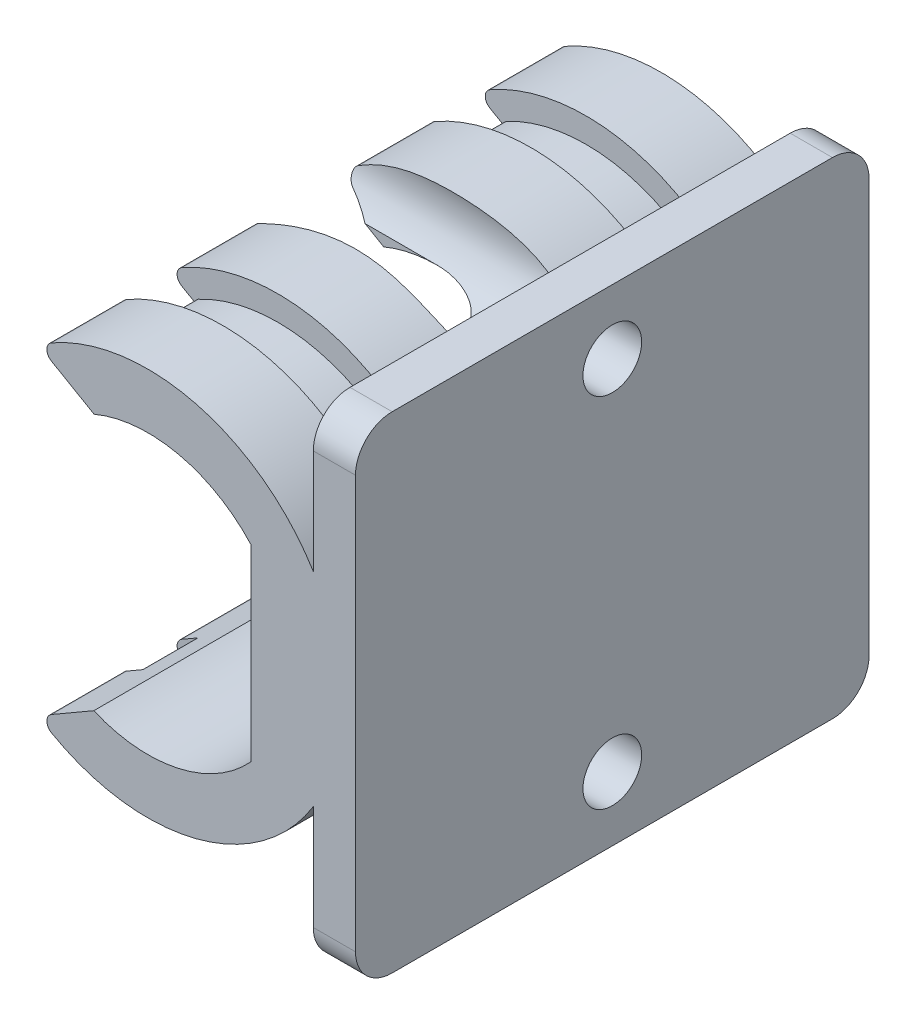
from build123d import *

# Parameters (mm, degrees)
SALIENTE_EXTRUIR1_DEPTH      = 14.6
SALIENTE_EXTRUIR1_DEPTH_BACK = 14.6
SALIENTE_EXTRUIR2_START      = -2.6
SALIENTE_EXTRUIR2_DEPTH      = 2.6
SALIENTE_EXTRUIR3_START      = -14.6
CROQUIS3_W                   = 2.3
CROQUIS3_H                   = 47.938039211
SALIENTE_EXTRUIR3_DEPTH      = 29.2
CROQUIS6_R                   = 1.6
CORTAR_EXTRUIR1_DEPTH        = 20
CROQUIS7_R                   = 2.8
CORTAR_EXTRUIR2_DEPTH        = 20
CROQUIS8_R                   = 2.8
CORTAR_EXTRUIR3_DEPTH        = 33
CROQUIS9_OUTSIDE_W           = 42.946
CROQUIS9_OUTSIDE_H           = 61.684
CROQUIS9_OUTSIDE_W_2         = 28
CROQUIS9_OUTSIDE_H_2         = 26.5
CORTAR_EXTRUIR4_DEPTH        = 33
CORTAR_EXTRUIR5_DEPTH        = 23.234812396
CORTAR_EXTRUIR5_DEPTH_BACK   = 23.234812396
CROQUIS10_W                  = 1.7
CROQUIS10_H                  = 3
CORTAR_EXTRUIR6_DEPTH        = 23.234812396
CORTAR_EXTRUIR6_DEPTH_BACK   = 23.234812396
REDONDEO1_R                  = 2
REDONDEO3_R                  = 0.5
CROQUIS15_W                  = 3
CROQUIS15_H                  = 1.5
SALIENTE_EXTRUIR4_REACH      = 26.646
CROQUIS16_W                  = 3
CROQUIS16_H                  = 0.184923787
SALIENTE_EXTRUIR5_REACH      = 26.646
CROQUIS17_W                  = 3
CROQUIS17_H                  = 0.184923787
REDONDEO6_R                  = 0.2
REDONDEO7_R                  = 0.5


with BuildPart() as part:
    # Croquis1 → Saliente-Extruir1 (new, two sides: drawn at the far end of the back side and taken through both)
    with BuildSketch(Plane.XY.offset(-SALIENTE_EXTRUIR1_DEPTH_BACK)):
        with BuildLine():
            Line((-9.894524811, -9.657282728), (-6.867524861, -7.909281629))
            ThreePointArc((-6.867524861, -7.909281629), (3.691458353, -0.918186433), (-6.851112712, 6.097633825))
            Line((-6.851112712, 6.097633825), (-9.894524811, 7.855112444))
            ThreePointArc((-9.894524811, 7.855112444), (6.67014921, -0.901085142), (-9.894524811, -9.657282728))
        make_face()
    extrude(amount=SALIENTE_EXTRUIR1_DEPTH + SALIENTE_EXTRUIR1_DEPTH_BACK)

    # Croquis2 → Saliente-Extruir2 (add)
    with BuildSketch(Plane.XY.offset(14.6).offset(SALIENTE_EXTRUIR2_START)):
        with BuildLine():
            Line((1.69167133, 4.22850409), (1.69167133, -6.047067348))
            ThreePointArc((1.69167133, -6.047067348), (3.69146357, -0.909281629), (1.69167133, 4.22850409))
        make_face()
    saliente_extruir2 = extrude(amount=SALIENTE_EXTRUIR2_DEPTH)

    # Simetría1: Saliente-Extruir2 across plane
    add(saliente_extruir2.mirror(Plane.XY))

    # Croquis3 → Saliente-Extruir3 (add)
    with BuildSketch(Plane.XY.offset(SALIENTE_EXTRUIR3_START)):
        with Locations((6.25, -0.90928163)):
            Rectangle(CROQUIS3_W, CROQUIS3_H)
    extrude(amount=SALIENTE_EXTRUIR3_DEPTH)

    # Croquis6 → Cortar-Extruir1 (cut)
    with BuildSketch(Plane(origin=(7.4, 0, 0), x_dir=(0, 0, -1), z_dir=(1, 0, 0))):
        with Locations(Location((0, 8.840718371, 0), (0, 0, 90))):
            Circle(CROQUIS6_R)
        with Locations(Location((0, -10.659281629, 0), (0, 0, 90))):
            Circle(CROQUIS6_R)
    extrude(amount=-CORTAR_EXTRUIR1_DEPTH, mode=Mode.SUBTRACT)

    # Croquis7 → Cortar-Extruir2 (cut)
    with BuildSketch(Plane.ZY.offset(-5.1)):
        with Locations((0, -10.659281629)):
            Circle(CROQUIS7_R)
    extrude(amount=CORTAR_EXTRUIR2_DEPTH, mode=Mode.SUBTRACT)

    # Croquis8 → Cortar-Extruir3 (cut)
    with BuildSketch(Plane.ZY.offset(-5.1)):
        with Locations((0, 8.840718371)):
            Circle(CROQUIS8_R)
    extrude(amount=CORTAR_EXTRUIR3_DEPTH, mode=Mode.SUBTRACT)

    # Croquis9 outside → Cortar-Extruir4 (cut)
    with BuildSketch(Plane(origin=(7.4, 0, 0), x_dir=(0, 0, -1), z_dir=(1, 0, 0))):
        with Locations((0, -0.909)):
            Rectangle(CROQUIS9_OUTSIDE_W, CROQUIS9_OUTSIDE_H)
        with Locations((0, -0.909281629)):
            Rectangle(CROQUIS9_OUTSIDE_W_2, CROQUIS9_OUTSIDE_H_2, mode=Mode.SUBTRACT)
    extrude(amount=-CORTAR_EXTRUIR4_DEPTH, mode=Mode.SUBTRACT)

    # Croquis10 → Cortar-Extruir5 (cut, two sides: drawn at the far end of the back side and taken through both)
    with BuildSketch(Plane(origin=(0, 0, 0), x_dir=(1, 0, 0), z_dir=(0, 1, 0)).offset(-CORTAR_EXTRUIR5_DEPTH_BACK)):
        with Locations((4.25, 8.400005124)):
            Rectangle(CROQUIS10_W, CROQUIS10_H)
        with Locations((4.25, -8.400005124)):
            Rectangle(CROQUIS10_W, CROQUIS10_H)
    extrude(amount=CORTAR_EXTRUIR5_DEPTH + CORTAR_EXTRUIR5_DEPTH_BACK, mode=Mode.SUBTRACT)

    # Croquis11 → Cortar-Extruir6 (cut, two sides: drawn at the far end of the back side and taken through both)
    with BuildSketch(Plane(origin=(0, 0, 0), x_dir=(1, 0, 0), z_dir=(0, 1, 0)).offset(-CORTAR_EXTRUIR6_DEPTH_BACK)):
        Polygon((-12.518535399, 1.793593931), (-3.91121133, 1.793593931), (-3.91121133, -1.793519439), (-12.439482954, -1.790719456), align=None)
    extrude(amount=CORTAR_EXTRUIR6_DEPTH + CORTAR_EXTRUIR6_DEPTH_BACK, mode=Mode.SUBTRACT)

    # Redondeo1
    redondeo1_edges = [part.edges().sort_by_distance(p)[0] for p in [
        (6.25, 12.340718371, -14),
        (6.25, -14.159281629, -14),
        (6.25, -14.159281629, 14),
        (6.25, 12.340718371, 14),
    ]]
    fillet(redondeo1_edges, radius=REDONDEO1_R)

    # Redondeo3
    # the kernel refuses this fillet: 0.5 mm, written as the material it takes off along each edge
    with BuildSketch(Plane(origin=(-9.894524811, -9.657282728, 0.483565685), x_dir=(0.8483027718418479, -0.5295114798429189, 0), z_dir=(0, 0, 1)), Plane(origin=(-9.894524811, -9.657282728, -16.131008506), x_dir=(0.8483027718418479, -0.5295114798429189, 0), z_dir=(0, 0, 1))) as redondeo3_piece_1:
        with BuildLine():
            CenterArc((0.832293154, 0.499595414), REDONDEO3_R, 151.977590228, 120.327496284)
            Line((0.390911202, 0.734503849), (0, 0))
            ThreePointArc((0, 0), (0.426201701, -0.008574491), (0.852403402, 0))
        make_face()
    extrude(amount=15.647442821, mode=Mode.SUBTRACT)
    with BuildSketch(Plane(origin=(-9.894524811, 7.855112444, -16.131008506), x_dir=(0.8483027718418464, 0.5295114798429209, 0), z_dir=(0, 0, 1)), Plane(origin=(-9.894524811, 7.855112444, 0.489789265), x_dir=(0.8483027718418464, 0.5295114798429209, 0), z_dir=(0, 0, 1))) as redondeo3_piece_2:
        with BuildLine():
            CenterArc((0.832293154, -0.499595414), REDONDEO3_R, 87.694913488, 120.327496284)
            Line((0.390911202, -0.734503849), (0, 0))
            ThreePointArc((0, 0), (0.426201701, 0.008574491), (0.852403402, 0))
        make_face()
    extrude(amount=15.641219241, mode=Mode.SUBTRACT)

    # Cortar-Barrer2: sweep along a path in Croquis13
    with BuildLine(Plane.XY.offset(14)) as cortar_barrer2_path:
        ThreePointArc((5.1, 4.649699473), (-14.523109477, -0.901085142), (5.1, -6.451869757))
    # Croquis15 → Cortar-Barrer2 (sweep, cut)
    with BuildSketch(Plane(origin=(0.33944201, -0.324840749, 0), x_dir=(0, 0, -1), z_dir=(0.7224748271153197, -0.6913972260464234, 0))):
        with Locations((-8.400005124, 6.236716152)):
            Rectangle(CROQUIS15_W, CROQUIS15_H)
    cortar_barrer2 = sweep(path=cortar_barrer2_path.line, mode=Mode.SUBTRACT)

    # Simetría3: Cortar-Barrer2 across plane
    add(cortar_barrer2.mirror(Plane.XY), mode=Mode.SUBTRACT)

    # Croquis16 → Saliente-Extruir4 (add, up to next)
    with BuildSketch(Plane.ZY.offset(-5.1), mode=Mode.PRIVATE) as saliente_extruir4_sk1:
        with Locations((-8.400005124, 4.742161366)):
            Rectangle(CROQUIS16_W, CROQUIS16_H)
    saliente_extruir4_tool1 = extrude(saliente_extruir4_sk1.sketch, amount=-SALIENTE_EXTRUIR4_REACH, mode=Mode.PRIVATE) - part.part
    # Croquis16 → Saliente-Extruir4 (add, up to next)
    with BuildSketch(Plane.ZY.offset(-5.1), mode=Mode.PRIVATE) as saliente_extruir4_sk2:
        with Locations((8.400005124, 4.742161366)):
            Rectangle(CROQUIS16_W, CROQUIS16_H)
    saliente_extruir4_tool2 = extrude(saliente_extruir4_sk2.sketch, amount=-SALIENTE_EXTRUIR4_REACH, mode=Mode.PRIVATE) - part.part
    add(saliente_extruir4_tool1.solids().sort_by_distance((5.1, 4.742161, -8.400005))[0])
    add(saliente_extruir4_tool2.solids().sort_by_distance((5.1, 4.742161, 8.400005))[0])

    # Croquis17 → Saliente-Extruir5 (add, up to next)
    with BuildSketch(Plane.ZY.offset(-5.1), mode=Mode.PRIVATE) as saliente_extruir5_sk1:
        with Locations((-8.400005124, -6.544331651)):
            Rectangle(CROQUIS17_W, CROQUIS17_H)
    saliente_extruir5_tool1 = extrude(saliente_extruir5_sk1.sketch, amount=-SALIENTE_EXTRUIR5_REACH, mode=Mode.PRIVATE) - part.part
    # Croquis17 → Saliente-Extruir5 (add, up to next)
    with BuildSketch(Plane.ZY.offset(-5.1), mode=Mode.PRIVATE) as saliente_extruir5_sk2:
        with Locations((8.400005124, -6.544331651)):
            Rectangle(CROQUIS17_W, CROQUIS17_H)
    saliente_extruir5_tool2 = extrude(saliente_extruir5_sk2.sketch, amount=-SALIENTE_EXTRUIR5_REACH, mode=Mode.PRIVATE) - part.part
    add(saliente_extruir5_tool1.solids().sort_by_distance((5.1, -6.544332, -8.400005))[0])
    add(saliente_extruir5_tool2.solids().sort_by_distance((5.1, -6.544332, 8.400005))[0])

    # Redondeo6
    redondeo6_edges = [part.edges().sort_by_distance(p)[0] for p in [
        (-8.577810014, 7.094749395, 8.400005124),
        (-8.577810014, -8.896919679, 8.400005124),
        (-8.577810014, 7.094749395, -8.400005124),
        (-8.577810014, -8.896919679, -8.400005124),
    ]]
    fillet(redondeo6_edges, radius=REDONDEO6_R)

    # Redondeo7
    redondeo7_edges = [part.edges().sort_by_distance(p)[0] for p in [
        (3.4, 4.746120225, 8.400005124),
        (3.4, -6.548290509, 8.400005124),
        (3.4, -6.548290509, -8.400005124),
        (3.4, 4.746120225, -8.400005124),
    ]]
    fillet(redondeo7_edges, radius=REDONDEO7_R)


solid = part.part
